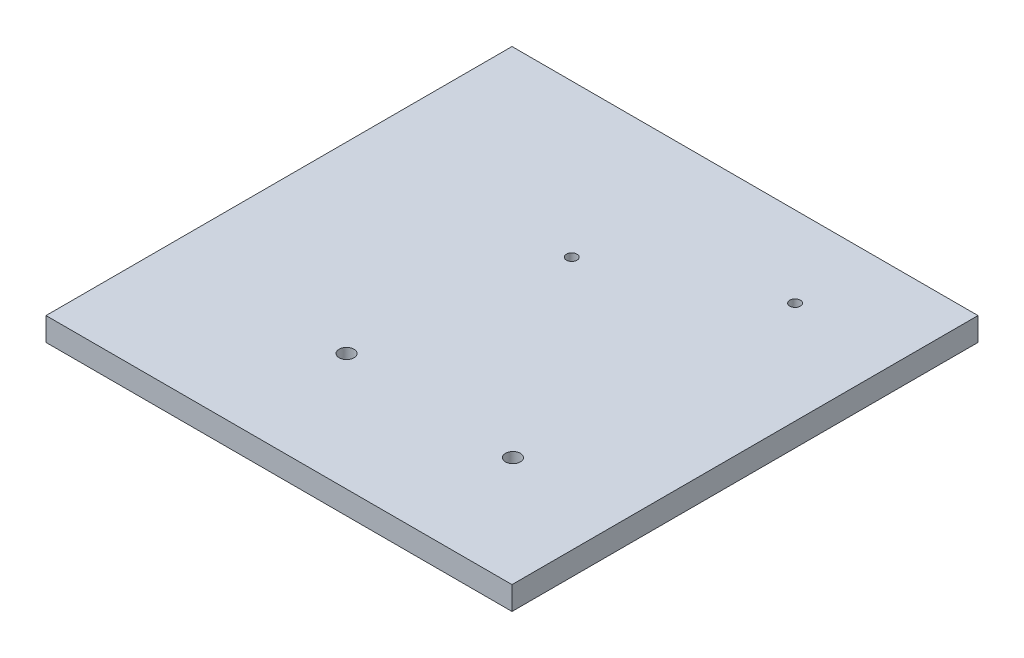
from build123d import *

# Parameters (mm, degrees)
SKETCH1_W           = 100
SKETCH1_H           = 100
SKETCH1_R           = 1.6
SKETCH1_R_2         = 1.13
BOSS_EXTRUDE1_DEPTH = 5


with BuildPart() as part:
    # Sketch1 → Boss-Extrude1 (new body)
    with BuildSketch(Plane(origin=(0, 0, 0), x_dir=(1, 0, 0), z_dir=(0, 1, 0))):
        Rectangle(SKETCH1_W, SKETCH1_H)
        with Locations((26.5, -26.3)):
            Circle(SKETCH1_R, mode=Mode.SUBTRACT)
        with Locations((-10.7, -24.8)):
            Circle(SKETCH1_R, mode=Mode.SUBTRACT)
        with Locations((28.07, 32.68)):
            Circle(SKETCH1_R_2, mode=Mode.SUBTRACT)
        with Locations((-4.44, 17.26)):
            Circle(SKETCH1_R_2, mode=Mode.SUBTRACT)
    extrude(amount=BOSS_EXTRUDE1_DEPTH)


solid = part.part
